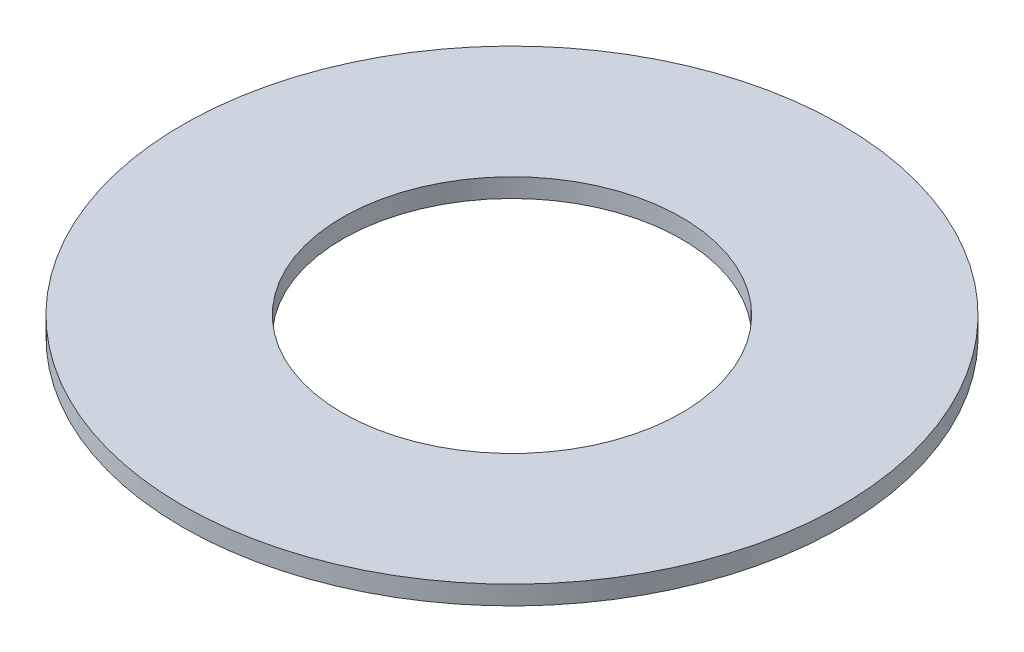
from build123d import *

# Parameters (mm, degrees)
SKETCH1_R           = 87.5
BOSS_EXTRUDE1_DEPTH = 5
SKETCH2_R           = 45
CUT_EXTRUDE1_DEPTH  = 124.844660765


with BuildPart() as part:
    # Sketch1 → Boss-Extrude1 (new body)
    with BuildSketch(Plane(origin=(0, 0, 0), x_dir=(1, 0, 0), z_dir=(0, 1, 0))):
        Circle(SKETCH1_R)
    extrude(amount=BOSS_EXTRUDE1_DEPTH)

    # Sketch2 → Cut-Extrude1 (cut, through all)
    with BuildSketch(Plane(origin=(0, 0, 0), x_dir=(1, 0, 0), z_dir=(0, 1, 0))):
        Circle(SKETCH2_R)
    extrude(amount=CUT_EXTRUDE1_DEPTH, mode=Mode.SUBTRACT)


solid = part.part
